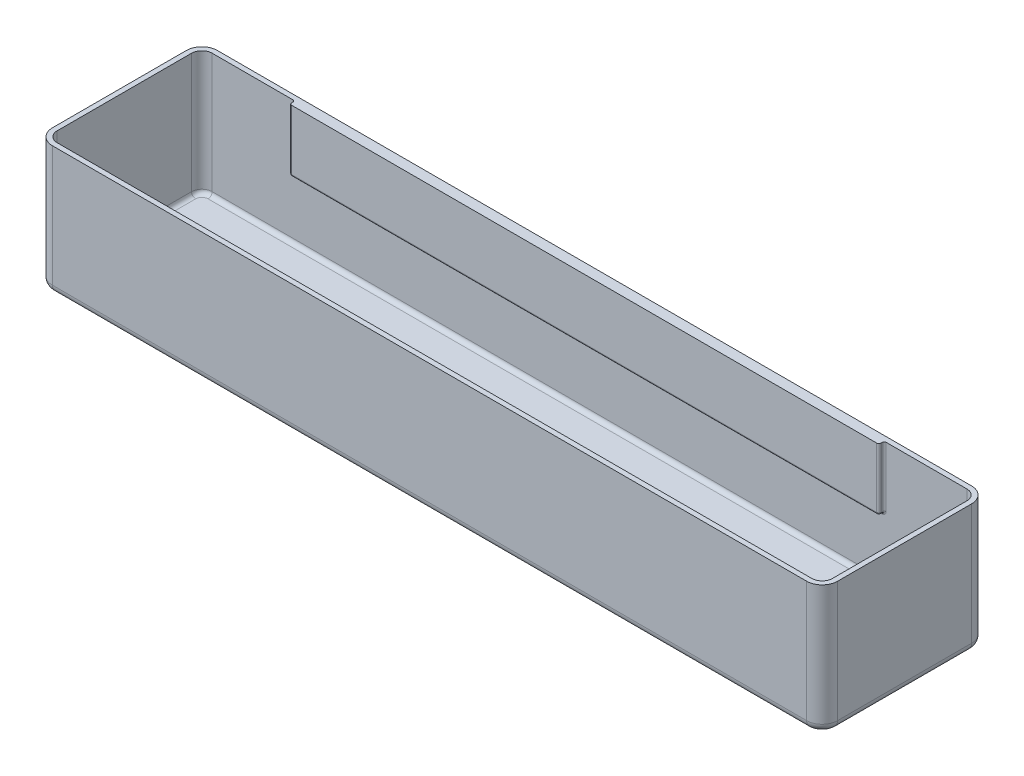
from build123d import *

# Parameters (mm, degrees)
SKETCH1_W           = 241.173
SKETCH1_H           = 50.673
SKETCH1_W_2         = 238.125
SKETCH1_H_2         = 47.625
BOSS_EXTRUDE1_DEPTH = 38.1
SKETCH2_W           = 241.173
SKETCH2_H           = 50.673
BOSS_EXTRUDE2_DEPTH = 1.524
FILLET1_R           = 3.175
FILLET2_R           = 4.7625
SKETCH4_R           = 12.065
CUT_EXTRUDE2_DEPTH  = 130.433780716
SKETCH5_W           = 180.975
SKETCH5_H           = 19.05
BOSS_EXTRUDE3_DEPTH = 1.651
FILLET3_R           = 0.635
FILLET4_R           = 1.27
FILLET5_R           = 2.54


with BuildPart() as part:
    # Sketch1 → Boss-Extrude1 (new body)
    with BuildSketch(Plane(origin=(0, 0, 0), x_dir=(1, 0, 0), z_dir=(0, 1, 0))):
        Rectangle(SKETCH1_W, SKETCH1_H)
        Rectangle(SKETCH1_W_2, SKETCH1_H_2, mode=Mode.SUBTRACT)
    extrude(amount=BOSS_EXTRUDE1_DEPTH)

    # Sketch2 → Boss-Extrude2 (add)
    with BuildSketch(Plane.XZ):
        Rectangle(SKETCH2_W, SKETCH2_H)
        with BuildLine():
            ThreePointArc((104.470662284, 2.628830684), (106.341768246, 4.935118281), (104.035480649, 6.806224243))
            ThreePointArc((104.035480649, 6.806224243), (102.164374687, 4.499936646), (104.470662284, 2.628830684))
        make_face(mode=Mode.SUBTRACT)
        with BuildLine():
            ThreePointArc((73.637519351, -0.583224243), (75.508625313, 1.723063354), (73.202337716, 3.594169316))
            ThreePointArc((73.202337716, 3.594169316), (71.331231754, 1.287881719), (73.637519351, -0.583224243))
        make_face(mode=Mode.SUBTRACT)
    extrude(amount=BOSS_EXTRUDE2_DEPTH)

    # Fillet1
    fillet1_edges = [part.edges().sort_by_distance(p)[0] for p in [
        (119.0625, 19.05, -23.8125),
        (119.0625, 19.05, 23.8125),
        (-119.0625, 19.05, 23.8125),
        (-119.0625, 19.05, -23.8125),
    ]]
    fillet(fillet1_edges, radius=FILLET1_R)

    # Fillet2
    fillet2_edges = [part.edges().sort_by_distance(p)[0] for p in [
        (-120.5865, 18.288, -25.3365),
        (120.5865, 18.288, -25.3365),
        (120.5865, 18.288, 25.3365),
        (-120.5865, 18.288, 25.3365),
    ]]
    fillet(fillet2_edges, radius=FILLET2_R)

    # Sketch4 → Cut-Extrude2 (cut, through all)
    with BuildSketch(Plane.XZ.offset(1.524)):
        with Locations((88.8365, 3.1115)):
            Circle(SKETCH4_R)
    extrude(amount=-CUT_EXTRUDE2_DEPTH, mode=Mode.SUBTRACT)

    # Sketch5 → Boss-Extrude3 (add)
    with BuildSketch(Plane.XY.offset(-23.8125)):
        with Locations((0, 28.575)):
            Rectangle(SKETCH5_W, SKETCH5_H)
    extrude(amount=BOSS_EXTRUDE3_DEPTH)

    # Fillet3
    fillet3_edges = [part.edges().sort_by_distance(p)[0] for p in [
        (0, 19.05, -22.1615),
        (0, 19.05, -23.8125),
        (-90.4875, 28.575, -23.8125),
        (-90.4875, 28.575, -22.1615),
        (90.4875, 28.575, -22.1615),
        (90.4875, 28.575, -23.8125),
        (-90.4875, 19.05, -22.987),
        (90.4875, 19.05, -22.987),
    ]]
    fillet(fillet3_edges, radius=FILLET3_R)

    # Fillet4
    fillet4_edges = [part.edges().sort_by_distance(p)[0] for p in [
        (118.13256403, 0, -22.88256403),
        (119.0625, 0, 0),
        (118.13256403, 0, 22.88256403),
        (0, 0, 23.8125),
        (-118.13256403, 0, 22.88256403),
        (-119.0625, 0, 0),
        (-118.13256403, 0, -22.88256403),
        (0, 0, -23.8125),
    ]]
    fillet(fillet4_edges, radius=FILLET4_R)

    # Fillet5
    fillet5_edges = [part.edges().sort_by_distance(p)[0] for p in [
        (-119.191596045, -1.524, 23.941596045),
        (0, -1.524, 25.3365),
        (119.191596045, -1.524, 23.941596045),
        (120.5865, -1.524, 0),
        (119.191596045, -1.524, -23.941596045),
        (0, -1.524, -25.3365),
        (-119.191596045, -1.524, -23.941596045),
        (-120.5865, -1.524, 0),
    ]]
    fillet(fillet5_edges, radius=FILLET5_R)


solid = part.part
